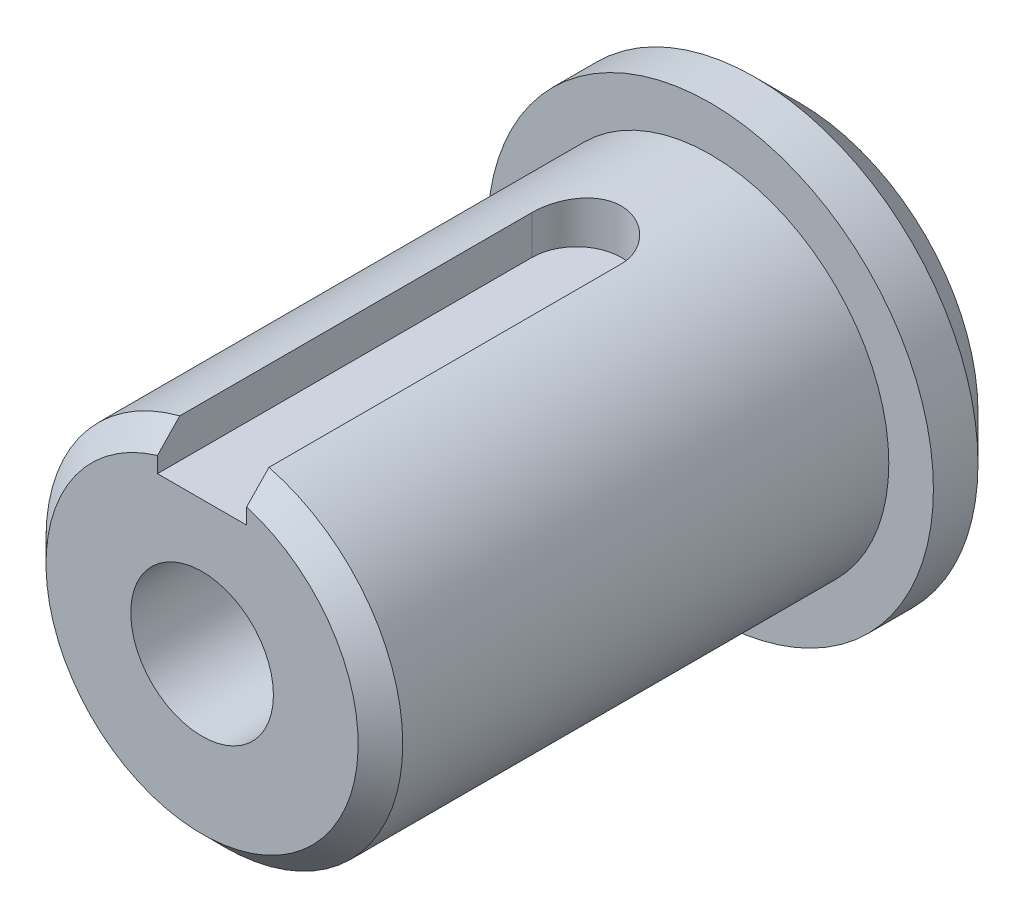
from build123d import *

# Parameters (mm, degrees)
CUT_EXTRUDE1_DEPTH = 1


with BuildPart() as part:
    # Sketch1 → Revolve1 (revolve)
    with BuildSketch(Plane(origin=(0, 0, 0), x_dir=(0, 0, -1), z_dir=(1, 0, 0))):
        Polygon((0, 1.6), (0, 4), (-1, 5), (-2, 5), (-2, 4), (-12.9, 4), (-13.4, 3.5), (-13.4, 1.6), align=None)
    revolve(axis=Axis((0, 0, 0), (0, 0, -1)))

    # Sketch2 → Cut-Extrude1 (cut)
    with BuildSketch(Plane(origin=(0, 4, 0), x_dir=(1, 0, 0), z_dir=(0, 1, 0))):
        with BuildLine():
            Line((-1, -13.4), (-1, -5))
            ThreePointArc((-1, -5), (0, -4), (1, -5))
            Line((1, -5), (1, -13.4))
            ThreePointArc((1, -13.4), (0, -14.4), (-1, -13.4))
        make_face()
    extrude(amount=-CUT_EXTRUDE1_DEPTH, mode=Mode.SUBTRACT)


solid = part.part
